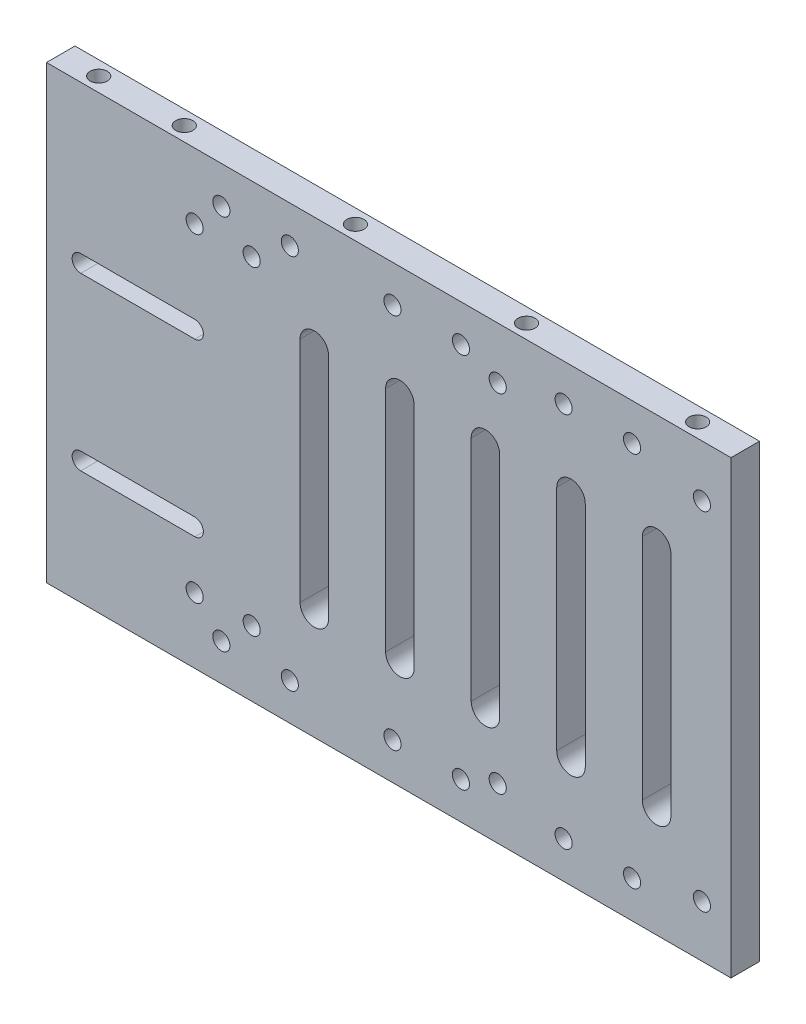
from build123d import *

# Parameters (mm, degrees)
SKETCH_1_W               = 120
SKETCH_1_H               = 79
EXTRUDE_1_DEPTH          = 5
SKETCH_2_R               = 3.1
CUT_EXTRUDE_1_DEPTH      = 1.5
SKETCH_3_R               = 1.5
CUT_EXTRUDE_2_DEPTH      = 72.920094549
PATTERN_LINEAR_1_COUNT   = 3
PATTERN_LINEAR_1_PITCH   = 30
MIRROR_2_COPY_1_SKETCH_R = 3.1
MIRROR_2_COPY_1_DEPTH    = 1.5
MIRROR_2_COPY_2_SKETCH_R = 3.1
MIRROR_2_COPY_2_DEPTH    = 1.5
MIRROR_2_COPY_3_SKETCH_R = 1.5
MIRROR_2_COPY_3_DEPTH    = 72.920094549
MIRROR_2_COPY_4_SKETCH_R = 1.5
MIRROR_2_COPY_4_DEPTH    = 72.920094549
MIRROR_2_COPY_5_SKETCH_R = 3.1
MIRROR_2_COPY_5_DEPTH    = 1.5
MIRROR_2_COPY_6_SKETCH_R = 1.5
MIRROR_2_COPY_6_DEPTH    = 72.920094549
CUT_EXTRUDE_3_DEPTH      = 1.5
CUT_EXTRUDE_4_DEPTH      = 72.920094549
SKETCH_7_R               = 1.5
CUT_EXTRUDE_6_DEPTH      = 5
SKETCH_9_R               = 1.5
CUT_EXTRUDE_7_DEPTH      = 73.008680032


with BuildPart() as part:
    # 草图1 → 凸台-拉伸1 (new body)
    with BuildSketch(Plane.XY):
        Rectangle(SKETCH_1_W, SKETCH_1_H)
    extrude(amount=EXTRUDE_1_DEPTH)

    # 草图2 → 切除-拉伸1 (cut)
    with BuildSketch(Plane(origin=(0, 0, 0), x_dir=(-1, 0, 0), z_dir=(0, 0, -1))):
        with Locations((-42.655984764, -33)):
            Circle(SKETCH_2_R)
        with Locations((-30.655984764, -33)):
            Circle(SKETCH_2_R)
    cut_extrude_1 = extrude(amount=-CUT_EXTRUDE_1_DEPTH, mode=Mode.SUBTRACT)

    # 草图3 → 切除-拉伸2 (cut, through all)
    with BuildSketch(Plane(origin=(0, 0, 1.5), x_dir=(-1, 0, 0), z_dir=(0, 0, -1))):
        with Locations((-42.655984764, -33)):
            Circle(SKETCH_3_R)
        with Locations((-30.655984764, -33)):
            Circle(SKETCH_3_R)
    cut_extrude_2 = extrude(amount=-CUT_EXTRUDE_2_DEPTH, mode=Mode.SUBTRACT)

    # 阵列(线性)1: 切除-拉伸1, 切除-拉伸2 ×3
    with Locations(*[(-i * PATTERN_LINEAR_1_PITCH, 0, 0) for i in range(1, PATTERN_LINEAR_1_COUNT)]):
        add(cut_extrude_1, mode=Mode.SUBTRACT)
        add(cut_extrude_2, mode=Mode.SUBTRACT)

    # 镜向2 copy 1 sketch → 镜向2 copy 1 (cut)
    with BuildSketch(Plane(origin=(-30, 0, 0), x_dir=(-1, 0, 0), z_dir=(0, 0, -1))):
        with Locations((-42.655984764, 33)):
            Circle(MIRROR_2_COPY_1_SKETCH_R)
        with Locations((-30.655984764, 33)):
            Circle(MIRROR_2_COPY_1_SKETCH_R)
    extrude(amount=-MIRROR_2_COPY_1_DEPTH, mode=Mode.SUBTRACT)

    # 镜向2 copy 2 sketch → 镜向2 copy 2 (cut)
    with BuildSketch(Plane(origin=(-60, 0, 0), x_dir=(-1, 0, 0), z_dir=(0, 0, -1))):
        with Locations((-42.655984764, 33)):
            Circle(MIRROR_2_COPY_2_SKETCH_R)
        with Locations((-30.655984764, 33)):
            Circle(MIRROR_2_COPY_2_SKETCH_R)
    extrude(amount=-MIRROR_2_COPY_2_DEPTH, mode=Mode.SUBTRACT)

    # 镜向2 copy 3 sketch → 镜向2 copy 3 (cut, through all)
    with BuildSketch(Plane(origin=(-30, 0, 1.5), x_dir=(-1, 0, 0), z_dir=(0, 0, -1))):
        with Locations((-42.655984764, 33)):
            Circle(MIRROR_2_COPY_3_SKETCH_R)
        with Locations((-30.655984764, 33)):
            Circle(MIRROR_2_COPY_3_SKETCH_R)
    extrude(amount=-MIRROR_2_COPY_3_DEPTH, mode=Mode.SUBTRACT)

    # 镜向2 copy 4 sketch → 镜向2 copy 4 (cut, through all)
    with BuildSketch(Plane(origin=(-60, 0, 1.5), x_dir=(-1, 0, 0), z_dir=(0, 0, -1))):
        with Locations((-42.655984764, 33)):
            Circle(MIRROR_2_COPY_4_SKETCH_R)
        with Locations((-30.655984764, 33)):
            Circle(MIRROR_2_COPY_4_SKETCH_R)
    extrude(amount=-MIRROR_2_COPY_4_DEPTH, mode=Mode.SUBTRACT)

    # 镜向2 copy 5 sketch → 镜向2 copy 5 (cut)
    with BuildSketch(Plane(origin=(0, 0, 0), x_dir=(-1, 0, 0), z_dir=(0, 0, -1))):
        with Locations((-42.655984764, 33)):
            Circle(MIRROR_2_COPY_5_SKETCH_R)
        with Locations((-30.655984764, 33)):
            Circle(MIRROR_2_COPY_5_SKETCH_R)
    extrude(amount=-MIRROR_2_COPY_5_DEPTH, mode=Mode.SUBTRACT)

    # 镜向2 copy 6 sketch → 镜向2 copy 6 (cut, through all)
    with BuildSketch(Plane(origin=(0, 0, 1.5), x_dir=(-1, 0, 0), z_dir=(0, 0, -1))):
        with Locations((-42.655984764, 33)):
            Circle(MIRROR_2_COPY_6_SKETCH_R)
        with Locations((-30.655984764, 33)):
            Circle(MIRROR_2_COPY_6_SKETCH_R)
    extrude(amount=-MIRROR_2_COPY_6_DEPTH, mode=Mode.SUBTRACT)

    # 草图4 → 切除-拉伸3 (cut)
    with BuildSketch(Plane(origin=(0, 0, 0), x_dir=(-1, 0, 0), z_dir=(0, 0, -1))):
        with BuildLine():
            Line((34, 15.1), (54, 15.1))
            ThreePointArc((54, 15.1), (57.1, 12), (54, 8.9))
            Line((54, 8.9), (34, 8.9))
            ThreePointArc((34, 8.9), (30.9, 12), (34, 15.1))
        make_face()
        with BuildLine():
            Line((34, -21.1), (54, -21.1))
            ThreePointArc((54, -21.1), (57.1, -18), (54, -14.9))
            Line((54, -14.9), (34, -14.9))
            ThreePointArc((34, -14.9), (30.9, -18), (34, -21.1))
        make_face()
    extrude(amount=-CUT_EXTRUDE_3_DEPTH, mode=Mode.SUBTRACT)

    # 草图5 → 切除-拉伸4 (cut, through all)
    with BuildSketch(Plane(origin=(0, 0, 1.5), x_dir=(-1, 0, 0), z_dir=(0, 0, -1))):
        with BuildLine():
            Line((54, 10.5), (34, 10.5))
            ThreePointArc((34, 10.5), (32.5, 12), (34, 13.5))
            Line((34, 13.5), (54, 13.5))
            ThreePointArc((54, 13.5), (55.5, 12), (54, 10.5))
        make_face()
        with BuildLine():
            Line((54, -16.5), (34, -16.5))
            ThreePointArc((34, -16.5), (32.5, -18), (34, -19.5))
            Line((34, -19.5), (54, -19.5))
            ThreePointArc((54, -19.5), (55.5, -18), (54, -16.5))
        make_face()
    extrude(amount=-CUT_EXTRUDE_4_DEPTH, mode=Mode.SUBTRACT)

    # 草图7 → 切除-拉伸6 (cut)
    with BuildSketch(Plane.XZ.offset(39.5)):
        with Locations((51.655984764, 2.5)):
            Circle(SKETCH_7_R)
        with Locations((21.655984764, 2.5)):
            Circle(SKETCH_7_R)
        with Locations((-8.344015236, 2.5)):
            Circle(SKETCH_7_R)
        with Locations((-38.344015236, 2.5)):
            Circle(SKETCH_7_R)
        with Locations((-53.344015236, 2.5)):
            Circle(SKETCH_7_R)
    cut_extrude_6 = extrude(amount=-CUT_EXTRUDE_6_DEPTH, mode=Mode.SUBTRACT)

    # 镜向3: 切除-拉伸6 across plane
    add(cut_extrude_6.mirror(Plane.ZX), mode=Mode.SUBTRACT)

    # 草图9 → 切除-拉伸7 (cut, through all)
    with BuildSketch(Plane(origin=(0, 0, 0), x_dir=(-1, 0, 0), z_dir=(0, 0, -1))):
        with Locations((24.027682272, -28)):
            Circle(SKETCH_9_R)
        with Locations((34.027682272, -28)):
            Circle(SKETCH_9_R)
        with Locations((24.027682272, 28)):
            Circle(SKETCH_9_R)
        with Locations((34.027682272, 28)):
            Circle(SKETCH_9_R)
        with Locations((-19.103783252, 30.4)):
            Circle(SKETCH_9_R)
        with Locations((-54.903783252, 30.4)):
            Circle(SKETCH_9_R)
        with Locations((-19.103783252, -30.4)):
            Circle(SKETCH_9_R)
        with Locations((-54.903783252, -30.4)):
            Circle(SKETCH_9_R)
        with BuildLine():
            Line((-49.452559424, -20.266203112), (-49.452559424, 19.733796888))
            ThreePointArc((-49.452559424, 19.733796888), (-46.952559424, 22.233796888), (-44.452559424, 19.733796888))
            Line((-44.452559424, 19.733796888), (-44.452559424, -20.266203112))
            ThreePointArc((-44.452559424, -20.266203112), (-46.952559424, -22.766203112), (-49.452559424, -20.266203112))
        make_face()
        with BuildLine():
            Line((-34.452559424, -20.266203112), (-34.452559424, 19.733796888))
            ThreePointArc((-34.452559424, 19.733796888), (-31.952559424, 22.233796888), (-29.452559424, 19.733796888))
            Line((-29.452559424, 19.733796888), (-29.452559424, -20.266203112))
            ThreePointArc((-29.452559424, -20.266203112), (-31.952559424, -22.766203112), (-34.452559424, -20.266203112))
        make_face()
        with BuildLine():
            Line((-19.452559424, -20.266203112), (-19.452559424, 19.733796888))
            ThreePointArc((-19.452559424, 19.733796888), (-16.952559424, 22.233796888), (-14.452559424, 19.733796888))
            Line((-14.452559424, 19.733796888), (-14.452559424, -20.266203112))
            ThreePointArc((-14.452559424, -20.266203112), (-16.952559424, -22.766203112), (-19.452559424, -20.266203112))
        make_face()
        with BuildLine():
            Line((-4.452559424, -20.266203112), (-4.452559424, 19.733796888))
            ThreePointArc((-4.452559424, 19.733796888), (-1.952559424, 22.233796888), (0.547440576, 19.733796888))
            Line((0.547440576, 19.733796888), (0.547440576, -20.266203112))
            ThreePointArc((0.547440576, -20.266203112), (-1.952559424, -22.766203112), (-4.452559424, -20.266203112))
        make_face()
        with BuildLine():
            Line((10.547440576, -20.266203112), (10.547440576, 19.733796888))
            ThreePointArc((10.547440576, 19.733796888), (13.047440576, 22.233796888), (15.547440576, 19.733796888))
            Line((15.547440576, 19.733796888), (15.547440576, -20.266203112))
            ThreePointArc((15.547440576, -20.266203112), (13.047440576, -22.766203112), (10.547440576, -20.266203112))
        make_face()
    extrude(amount=-CUT_EXTRUDE_7_DEPTH, mode=Mode.SUBTRACT)


solid = part.part
